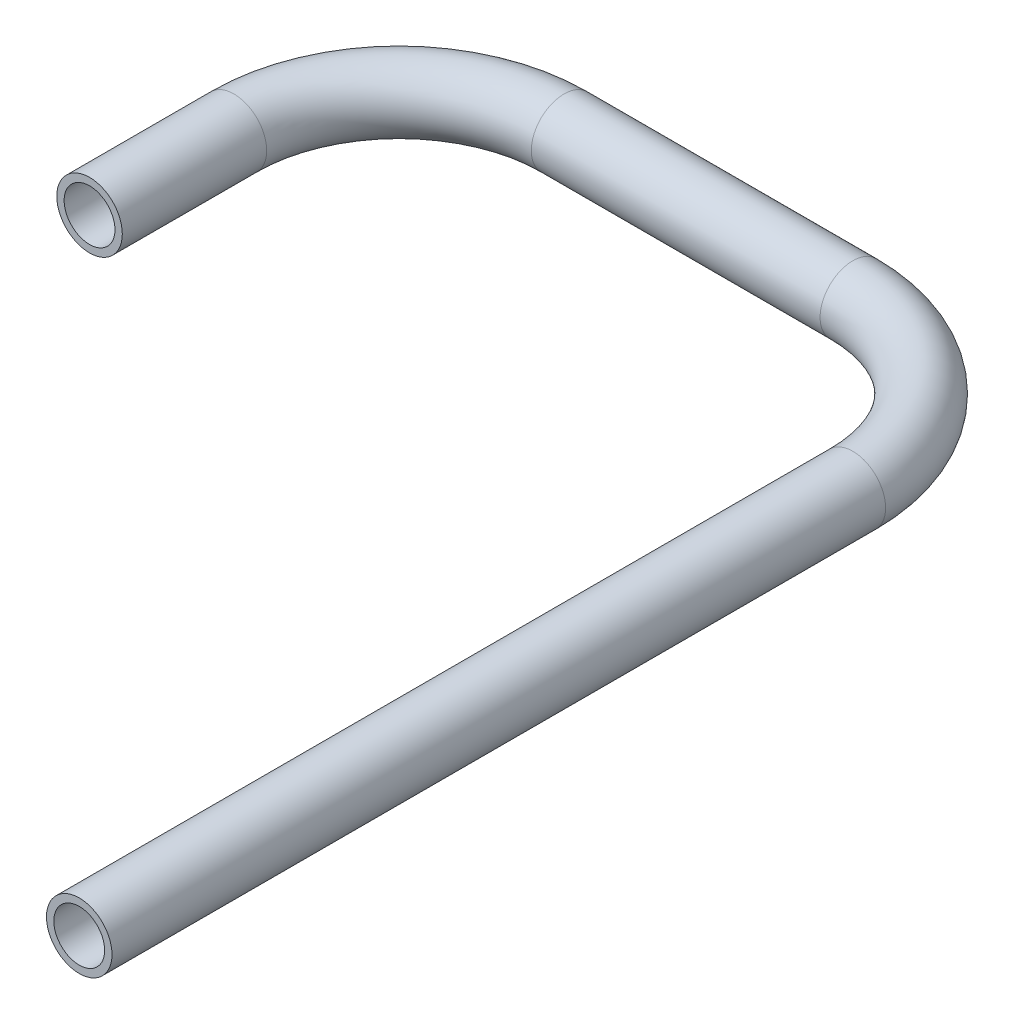
from build123d import *

# Parameters (mm, degrees)
SKETCH2_R   = 3.175
SKETCH2_R_2 = 2.4638


with BuildPart() as part:
    # Sweep-Thin1: sweep along a path in Sketch1
    with BuildLine(Plane(origin=(0, 0, 0), x_dir=(1, 0, 0), z_dir=(0, 1, 0))) as sweep_thin1_path:
        Line((0, 0), (0, 14))
        ThreePointArc((0, 14), (4.686291501, 25.313708499), (16, 30))
        Line((16, 30), (44, 30))
        ThreePointArc((44, 30), (55.313708499, 25.313708499), (60, 14))
        Line((60, 14), (60, -61))
    # Sketch2 → Sweep-Thin1 (sweep)
    with BuildSketch(Plane.XY):
        Circle(SKETCH2_R)
        Circle(SKETCH2_R_2, mode=Mode.SUBTRACT)
    sweep(path=sweep_thin1_path.line)


solid = part.part
